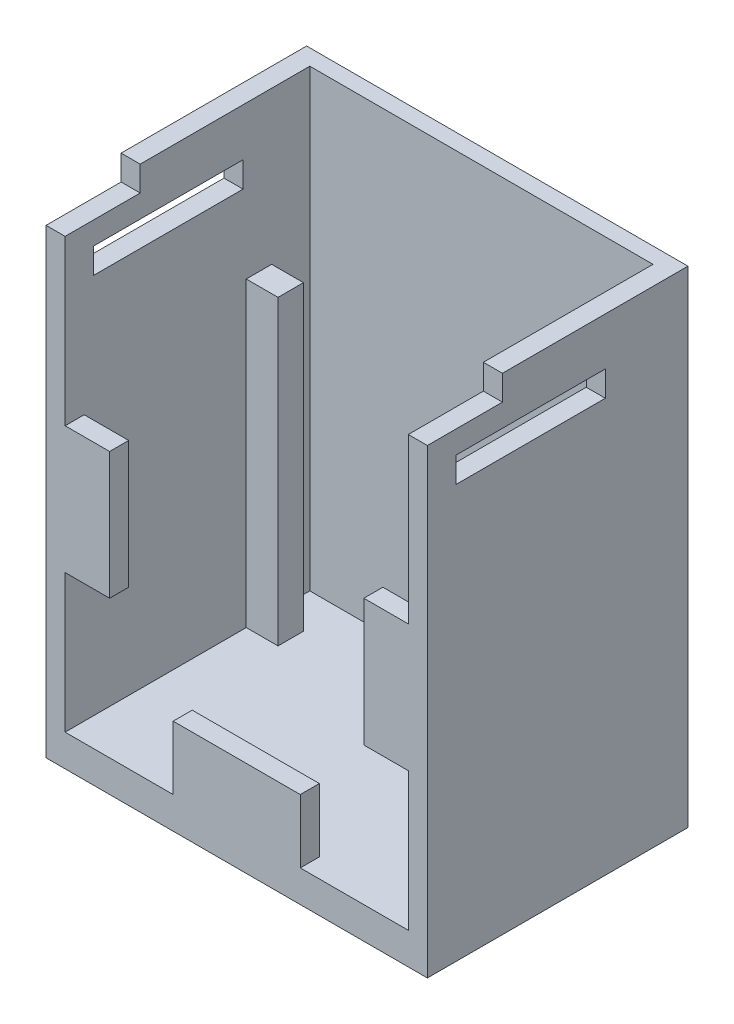
from build123d import *

# Parameters (mm, degrees)
INITIAL_BLOCK_DEPTH      = 19.05
INITIAL_BLOCK_DEPTH_BACK = 1.778
SKETCH1_W                = 30.48
SKETCH1_H                = 40.64
SKETCH2_W                = 27.432
SKETCH2_H                = 19.558
INITIAL_CUT_DEPTH        = 38.1
SKETCH20_W               = 5.08
SKETCH20_H               = 10.16
SKETCH20_W_2             = 10.16
SKETCH20_H_2             = 5.08
BOSS_EXTRUDE1_DEPTH      = 1.524
SKETCH21_W               = 2.032
SKETCH21_H               = 24.13
BOSS_EXTRUDE2_DEPTH      = 2.54
CUT_EXTRUDE6_REACH       = 46.012
SKETCH27_W               = 11.938
SKETCH27_H               = 2.032
SKETCH28_W               = 30.48
SKETCH28_H               = 1.778
CUT_EXTRUDE7_DEPTH       = 37.210815843
SKETCH29_W               = 30.48
SKETCH29_H               = 2
CUT_EXTRUDE8_DEPTH       = 6


with BuildPart() as part:
    # Sketch1 → Initial Block (new, two sides: drawn at the far end of the back side and taken through both)
    with BuildSketch(Plane.XY.offset(-INITIAL_BLOCK_DEPTH_BACK)):
        with Locations((0, -5.08)):
            Rectangle(SKETCH1_W, SKETCH1_H)
    extrude(amount=INITIAL_BLOCK_DEPTH + INITIAL_BLOCK_DEPTH_BACK)

    # Sketch2 → Initial Cut (cut)
    with BuildSketch(Plane(origin=(0, 15.24, 0), x_dir=(1, 0, 0), z_dir=(0, 1, 0))):
        with Locations((0, -9.271)):
            Rectangle(SKETCH2_W, SKETCH2_H)
    extrude(amount=-INITIAL_CUT_DEPTH, mode=Mode.SUBTRACT)

    # Sketch20 → Boss-Extrude1 (add)
    with BuildSketch(Plane.XY.offset(19.05)):
        with Locations((-12.7, -6.731)):
            Rectangle(SKETCH20_W, SKETCH20_H)
        with Locations((12.7, -6.731)):
            Rectangle(SKETCH20_W, SKETCH20_H)
        with Locations((0, -20.32)):
            Rectangle(SKETCH20_W_2, SKETCH20_H_2)
    extrude(amount=-BOSS_EXTRUDE1_DEPTH)

    # Sketch21 → Boss-Extrude2 (add)
    with BuildSketch(Plane(origin=(-13.716, 0, 0), x_dir=(0, 0, -1), z_dir=(1, 0, 0))):
        with Locations((-3.556, -10.795)):
            Rectangle(SKETCH21_W, SKETCH21_H)
    boss_extrude2 = extrude(amount=BOSS_EXTRUDE2_DEPTH)

    # Mirror2: Boss-Extrude2 across plane
    add(boss_extrude2.mirror(Plane(origin=(0, 0, 0), x_dir=(0, 0, 1), z_dir=(1, 0, 0))))

    # Sketch27 → Cut-Extrude6 (cut, up to next)
    with BuildSketch(Plane(origin=(15.24, 0, 0), x_dir=(0, 0, -1), z_dir=(1, 0, 0)), mode=Mode.PRIVATE) as cut_extrude6_sk1:
        with Locations((-10.795, 8.636)):
            Rectangle(SKETCH27_W, SKETCH27_H)
    cut_extrude6_tool1 = extrude(cut_extrude6_sk1.sketch, amount=-CUT_EXTRUDE6_REACH, mode=Mode.PRIVATE) & part.part
    cut_extrude6 = cut_extrude6_tool1.solids().sort_by_distance((15.24, 8.636, 10.795))[0]
    add(cut_extrude6, mode=Mode.SUBTRACT)

    # Mirror6: Cut-Extrude6 across plane
    add(cut_extrude6.mirror(Plane(origin=(0, 0, 0), x_dir=(0, 0, 1), z_dir=(1, 0, 0))), mode=Mode.SUBTRACT)

    # Sketch28 → Cut-Extrude7 (cut, through all)
    with BuildSketch(Plane.XY.offset(19.05)):
        with Locations((0, 14.351)):
            Rectangle(SKETCH28_W, SKETCH28_H)
    extrude(amount=-CUT_EXTRUDE7_DEPTH, mode=Mode.SUBTRACT)

    # Sketch29 → Cut-Extrude8 (cut)
    with BuildSketch(Plane.XY.offset(19.05)):
        with Locations((0, 12.462)):
            Rectangle(SKETCH29_W, SKETCH29_H)
    extrude(amount=-CUT_EXTRUDE8_DEPTH, mode=Mode.SUBTRACT)


solid = part.part
